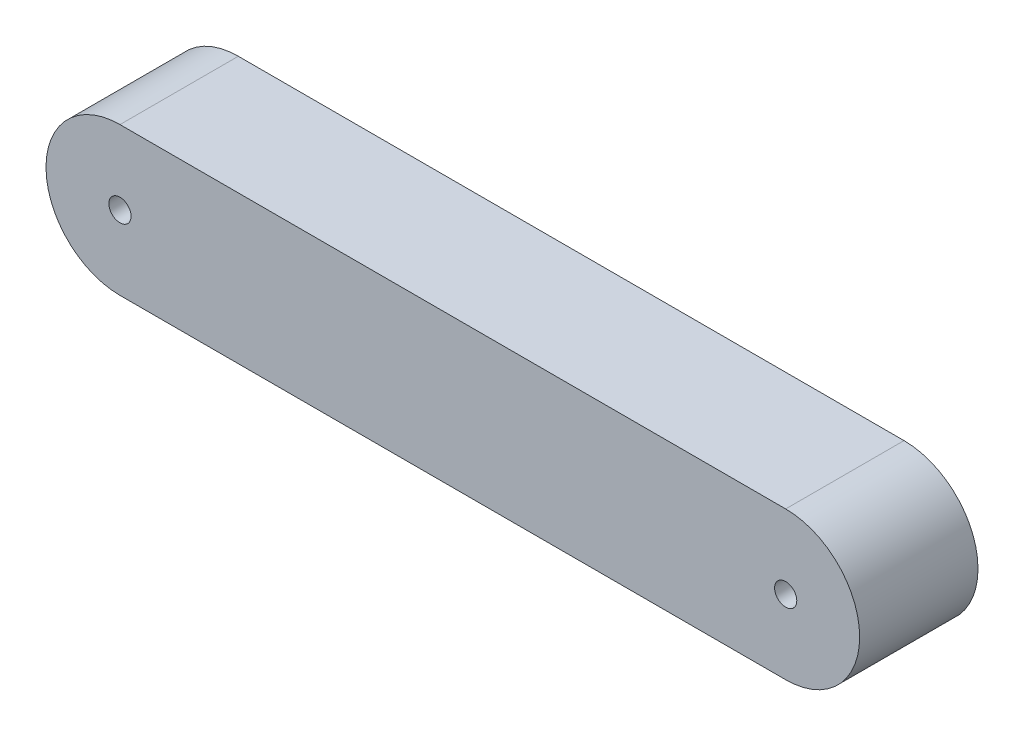
from build123d import *

# Parameters (mm, degrees)
BOSS_EXTRUDE2_DEPTH = 16
SKETCH2_R           = 1.5
CUT_EXTRUDE1_DEPTH  = 16


with BuildPart() as part:
    # Sketch1 → Boss-Extrude2 (new body)
    with BuildSketch(Plane.XY):
        with BuildLine():
            Line((86.254873389, 2.099543411), (-3.745126611, 2.099543411))
            ThreePointArc((-3.745126611, 2.099543411), (-13.745126611, -7.900456589), (-3.745126611, -17.900456589))
            Line((-3.745126611, -17.900456589), (86.254873389, -17.900456589))
            ThreePointArc((86.254873389, -17.900456589), (96.254873389, -7.900456589), (86.254873389, 2.099543411))
        make_face()
    extrude(amount=BOSS_EXTRUDE2_DEPTH)

    # Sketch2 → Cut-Extrude1 (cut)
    with BuildSketch(Plane.XY.offset(16)):
        with Locations((-3.745126611, -7.900456589)):
            Circle(SKETCH2_R)
        with Locations((86.254873389, -7.900456589)):
            Circle(SKETCH2_R)
    extrude(amount=-CUT_EXTRUDE1_DEPTH, mode=Mode.SUBTRACT)


solid = part.part
